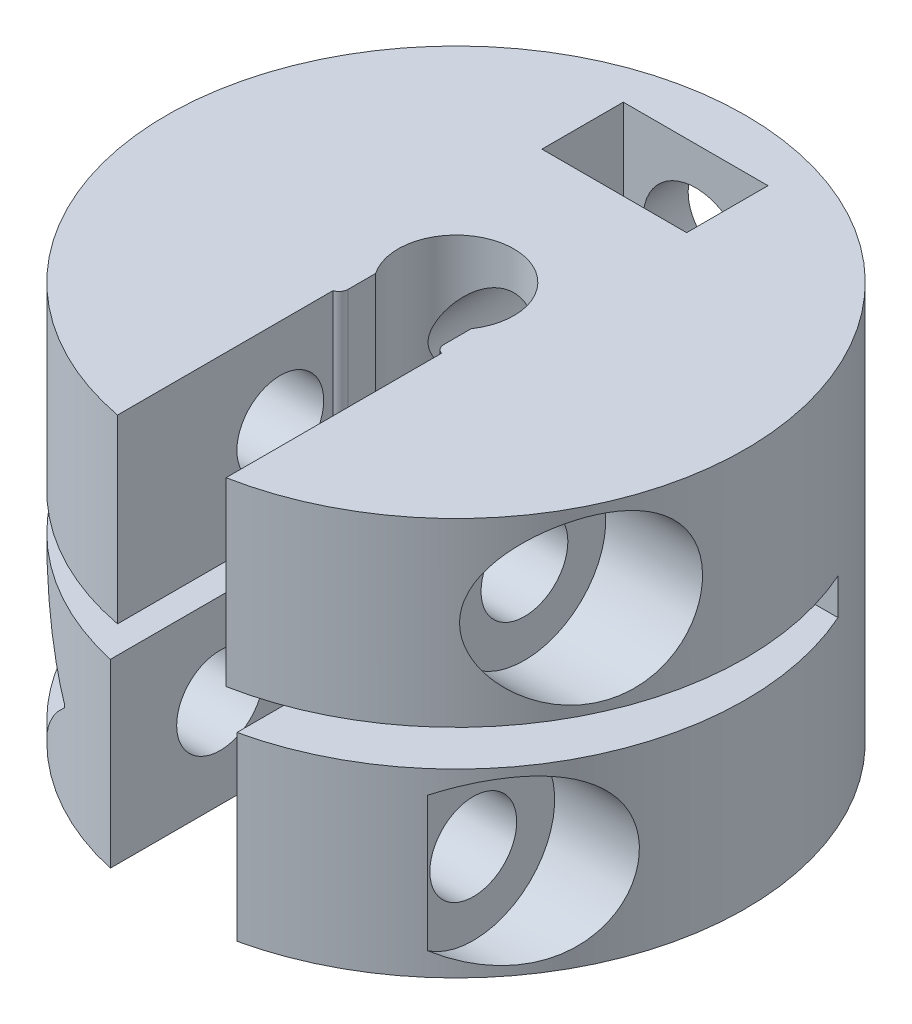
from build123d import *
from build123d.topology import SkipClean

# Parameters (mm, degrees)
SKETCH1_W                            = 4.75
SKETCH1_H                            = 7
FILLET1_R                            = 1
SKETCH16_W                           = 16
SKETCH16_H                           = 1
CUT_EXTRUDE5_DEPTH                   = 1
CUT_EXTRUDE5_DIRECTION_2_REACH       = 18.492
CUT_EXTRUDE6_REACH                   = 15.304
SKETCH17_W                           = 3.5
SKETCH17_H                           = 5.261387212
CUT_EXTRUDE7_DEPTH                   = 18.408690359
CUT_EXTRUDE7_DEPTH_BACK              = 18.408690359
SKETCH18_R                           = 1.2
CUT_EXTRUDE10_START                  = -6
SKETCH21_R                           = 1.6
CUT_EXTRUDE10_DEPTH                  = 6
CUT_EXTRUDE11_DEPTH                  = 18.26991621
CUT_EXTRUDE11_DEPTH_BACK             = 18.26991621
SKETCH22_R                           = 1.2
CUT_EXTRUDE9_REACH                   = 20.603
CUT_EXTRUDE9_END_RADIUS              = 8
SKETCH20_R                           = 1.2
CUT_EXTRUDE12_REACH                  = 21.585
SKETCH19_R                           = 2.25
CUT_EXTRUDE13_REACH                  = 21.585
CUT_EXTRUDE13_END_RADIUS             = 8
SKETCH24_R                           = 2.25
CUT_EXTRUDE14_REACH                  = 18.492
CUT_EXTRUDE14_END_RADIUS             = 8
SKETCH25_W                           = 2.25
SKETCH25_H                           = 1
CUT_EXTRUDE14_DIRECTION_2_REACH      = 18.492
CUT_EXTRUDE14_DIRECTION_2_END_RADIUS = 8
M2_5_CLEARANCE_HOLE1_D               = 2.9
M2_5_CLEARANCE_HOLE1_DEPTH           = 8.029752102
M2_5_CLEARANCE_HOLE1_TIP             = 0.871247898
CUT_EXTRUDE15_START                  = -12
SKETCH29_W                           = 4
SKETCH29_H                           = 2.25
CUT_EXTRUDE15_DEPTH                  = 12
FILLET3_R                            = 0.25
SKETCH30_R                           = 8
CUT_EXTRUDE19_DEPTH                  = 1
BOSS_EXTRUDE1_START                  = 1
BOSS_EXTRUDE1_DEPTH                  = 1


with BuildPart() as part:
    # Sketch1 → Revolve1 (revolve)
    with BuildSketch(Plane.XY, mode=Mode.PRIVATE) as revolve1_sk:
        with Locations((5.625, 3.5)):
            Rectangle(SKETCH1_W, SKETCH1_H)
    revolve(revolve1_sk.sketch.rotate(Axis((0, 0, 0), (0, 1, 0)), 90), axis=Axis((0, 0, 0), (0, 1, 0)))

    # Sketch1<3> → Revolve2 (revolve)
    with BuildSketch(Plane.XY, mode=Mode.PRIVATE) as revolve2_sk:
        Polygon((1.6, 7), (3.25, 7), (8, 7), (8, 12), (1.6, 12), align=None)
    revolve(revolve2_sk.sketch.rotate(Axis((0, 0, 0), (0, 1, 0)), 90), axis=Axis((0, 0, 0), (0, 1, 0)))

    # Fillet1
    fillet1_edges = [part.edges().sort_by_distance(p)[0] for p in [
        (0, 12, 8),
    ]]
    fillet(fillet1_edges, radius=FILLET1_R)

    # Sketch16 → Cut-Extrude5 (cut)
    with BuildSketch(Plane.XY):
        with Locations((0, 5.5)):
            Rectangle(SKETCH16_W, SKETCH16_H)
    extrude(amount=-CUT_EXTRUDE5_DEPTH, mode=Mode.SUBTRACT)

    # Sketch16 → Cut-Extrude5 direction 2 (cut, up to next)
    with BuildSketch(Plane.XY, mode=Mode.PRIVATE) as cut_extrude5_direction_2_sk1:
        with Locations((0, 5.5)):
            Rectangle(SKETCH16_W, SKETCH16_H)
    cut_extrude5_direction_2_tool1 = extrude(cut_extrude5_direction_2_sk1.sketch, amount=CUT_EXTRUDE5_DIRECTION_2_REACH, mode=Mode.PRIVATE) & part.part
    add(cut_extrude5_direction_2_tool1.solids().sort_by_distance((0, 5.5, 0))[0], mode=Mode.SUBTRACT)

    # Sketch17 → Cut-Extrude6 (cut, up to next)
    with BuildSketch(Plane(origin=(0, 5, 0), x_dir=(1, 0, 0), z_dir=(0, 1, 0)), mode=Mode.PRIVATE) as cut_extrude6_sk1:
        with Locations((0, -5.369306394)):
            Rectangle(SKETCH17_W, SKETCH17_H)
    cut_extrude6_tool1 = extrude(cut_extrude6_sk1.sketch, amount=-CUT_EXTRUDE6_REACH, mode=Mode.PRIVATE) & part.part
    add(cut_extrude6_tool1.solids().sort_by_distance((0, 5, 5.369306))[0], mode=Mode.SUBTRACT)

    # Sketch18 → Cut-Extrude7 (cut, two sides: drawn at the far end of the back side and taken through both)
    with BuildSketch(Plane.ZY.offset(-1.75).offset(-CUT_EXTRUDE7_DEPTH_BACK)):
        with Locations((4.772430143, 2.5)):
            Circle(SKETCH18_R)
    extrude(amount=CUT_EXTRUDE7_DEPTH + CUT_EXTRUDE7_DEPTH_BACK, mode=Mode.SUBTRACT)

    # Sketch21 → Cut-Extrude10 (cut)
    with BuildSketch(Plane(origin=(0, 12, 0), x_dir=(1, 0, 0), z_dir=(0, 1, 0)).offset(CUT_EXTRUDE10_START)):
        Circle(SKETCH21_R)
        Polygon((-1.5, -1.9), (-1.5, -11.891029443), (1.5, -11.891029443), (1.5, -1.9), (1.322875656, -1.9), (1.322875656, -0.9), (-1.322875656, -0.9), (-1.322875656, -1.9), align=None)
    extrude(amount=CUT_EXTRUDE10_DEPTH, mode=Mode.SUBTRACT)

    # Sketch22 → Cut-Extrude11 (cut, two sides: drawn at the far end of the back side and taken through both)
    with BuildSketch(Plane(origin=(-1.5, 0, 0), x_dir=(0, 0, -1), z_dir=(1, 0, 0)).offset(-CUT_EXTRUDE11_DEPTH_BACK)):
        with Locations((-3.358116823, 8.5)):
            Circle(SKETCH22_R)
    extrude(amount=CUT_EXTRUDE11_DEPTH + CUT_EXTRUDE11_DEPTH_BACK, mode=Mode.SUBTRACT)

    # Cut-Extrude9: up to this cylinder (the profile starts inside it)
    cut_extrude9_end = Plane(origin=(0, 5.9847245, 0), z_dir=(0, -1, 0)) * Cylinder(CUT_EXTRUDE9_END_RADIUS, 65.175449, mode=Mode.PRIVATE)
    # Sketch20 → Cut-Extrude9 (cut, up to the surface)
    with BuildSketch(Plane(origin=(-3.75, 0, 0), x_dir=(0, 0, -1), z_dir=(1, 0, 0)), mode=Mode.PRIVATE) as cut_extrude9_sk1:
        Polygon((-2.463029066, 2.5), (-3.617729604, 4.5), (-5.927130681, 4.5), (-7.08183122, 2.5), (-5.927130681, 0.5), (-3.617729604, 0.5), align=None)
    cut_extrude9_tool1 = extrude(cut_extrude9_sk1.sketch, amount=-CUT_EXTRUDE9_REACH, mode=Mode.PRIVATE) & cut_extrude9_end
    add(cut_extrude9_tool1.solids().sort_by_distance((-3.75, 2.5, 4.77243))[0], mode=Mode.SUBTRACT)
    # Sketch20 → Cut-Extrude9 (cut, up to the surface)
    with BuildSketch(Plane(origin=(-3.75, 0, 0), x_dir=(0, 0, -1), z_dir=(1, 0, 0)), mode=Mode.PRIVATE) as cut_extrude9_sk2:
        Polygon((-1.048715746, 8.5), (-2.203416284, 10.5), (-4.512817361, 10.5), (-5.6675179, 8.5), (-4.512817361, 6.5), (-2.203416284, 6.5), align=None)
        with Locations((-3.358116823, 8.5)):
            Circle(SKETCH20_R, mode=Mode.SUBTRACT)
    cut_extrude9_tool2 = extrude(cut_extrude9_sk2.sketch, amount=-CUT_EXTRUDE9_REACH, mode=Mode.PRIVATE) & cut_extrude9_end
    add(cut_extrude9_tool2.solids().sort_by_distance((-3.75, 9.469449, 1.678981))[0], mode=Mode.SUBTRACT)

    # Sketch19 → Cut-Extrude12 (cut, up to next)
    with BuildSketch(Plane.ZY.offset(-5.25), mode=Mode.PRIVATE) as cut_extrude12_sk1:
        with Locations((4.772430143, 2.5)):
            Circle(SKETCH19_R)
    cut_extrude12_tool1 = extrude(cut_extrude12_sk1.sketch, amount=-CUT_EXTRUDE12_REACH, mode=Mode.PRIVATE) & part.part
    add(cut_extrude12_tool1.solids().sort_by_distance((5.25, 2.5, 4.77243))[0], mode=Mode.SUBTRACT)

    # Cut-Extrude13: up to this cylinder (the profile starts inside it)
    cut_extrude13_end = Plane(origin=(0, 8.5, 0), z_dir=(0, -1, 0)) * Cylinder(CUT_EXTRUDE13_END_RADIUS, 60.17, mode=Mode.PRIVATE)
    # Sketch24 → Cut-Extrude13 (cut, up to the surface)
    with BuildSketch(Plane.ZY.offset(-5.25), mode=Mode.PRIVATE) as cut_extrude13_sk1:
        with Locations((3.358116823, 8.5)):
            Circle(SKETCH24_R)
    cut_extrude13_tool1 = extrude(cut_extrude13_sk1.sketch, amount=-CUT_EXTRUDE13_REACH, mode=Mode.PRIVATE) & cut_extrude13_end
    add(cut_extrude13_tool1.solids().sort_by_distance((5.25, 8.5, 3.358117))[0], mode=Mode.SUBTRACT)

    # Cut-Extrude14: up to this cylinder (the profile starts inside it)
    cut_extrude14_end = Plane(origin=(0, 5.5, 0), z_dir=(0, -1, 0)) * Cylinder(CUT_EXTRUDE14_END_RADIUS, 53.984, mode=Mode.PRIVATE)
    # Sketch25 → Cut-Extrude14 (cut, up to the surface)
    with BuildSketch(Plane.ZY, mode=Mode.PRIVATE) as cut_extrude14_sk1:
        with Locations((-2.125, 5.5)):
            Rectangle(SKETCH25_W, SKETCH25_H)
    cut_extrude14_tool1 = extrude(cut_extrude14_sk1.sketch, amount=-CUT_EXTRUDE14_REACH, mode=Mode.PRIVATE) & cut_extrude14_end
    add(cut_extrude14_tool1.solids().sort_by_distance((0, 5.5, -2.125))[0], mode=Mode.SUBTRACT)

    # Cut-Extrude14 direction 2: up to this cylinder (the profile starts inside it)
    cut_extrude14_direction_2_end = Plane(origin=(0, 5.5, 0), z_dir=(0, -1, 0)) * Cylinder(CUT_EXTRUDE14_DIRECTION_2_END_RADIUS, 53.984, mode=Mode.PRIVATE)
    # Sketch25 → Cut-Extrude14 direction 2 (cut, up to the surface)
    with BuildSketch(Plane.ZY, mode=Mode.PRIVATE) as cut_extrude14_direction_2_sk1:
        with Locations((-2.125, 5.5)):
            Rectangle(SKETCH25_W, SKETCH25_H)
    cut_extrude14_direction_2_tool1 = extrude(cut_extrude14_direction_2_sk1.sketch, amount=CUT_EXTRUDE14_DIRECTION_2_REACH, mode=Mode.PRIVATE) & cut_extrude14_direction_2_end
    add(cut_extrude14_direction_2_tool1.solids().sort_by_distance((0, 5.5, -2.125))[0], mode=Mode.SUBTRACT)

    # M2.5 Clearance Hole1
    with Locations(Plane(origin=(0, 0, -8), x_dir=(-1, 0, 0), z_dir=(0, 0, -1))):
        with Locations((0, 8.5), (0, 2.5)):
            Hole(M2_5_CLEARANCE_HOLE1_D / 2, depth=M2_5_CLEARANCE_HOLE1_DEPTH)
            with Locations((0, 0, -(M2_5_CLEARANCE_HOLE1_DEPTH + M2_5_CLEARANCE_HOLE1_TIP / 2))):  # 118° drill point
                Cone(0, M2_5_CLEARANCE_HOLE1_D / 2, M2_5_CLEARANCE_HOLE1_TIP, mode=Mode.SUBTRACT)

    # Sketch29 → Cut-Extrude15 (cut)
    with BuildSketch(Plane(origin=(0, 12, 0), x_dir=(1, 0, 0), z_dir=(0, 1, 0)).offset(CUT_EXTRUDE15_START)):
        with Locations((0, 5.5)):
            Rectangle(SKETCH29_W, SKETCH29_H)
    extrude(amount=CUT_EXTRUDE15_DEPTH, mode=Mode.SUBTRACT)

    # Fillet3
    # the kernel refuses this fillet: 0.25 mm, written as the material it takes off along each edge
    with BuildSketch(Plane(origin=(-1.322875656, 6.402143732, 1.9), x_dir=(-1, 0, 0), z_dir=(0, 1, 0))) as fillet3_piece_1:
        with BuildLine():
            CenterArc((0.25, -0.239142507), FILLET3_R, 106.94793725, 73.05206275)
            Line((0, -0.239142507), (-0.005, -0.239142507))
            Line((-0.005, -0.239142507), (-0.005, 0))
            Line((-0.005, 0), (0, 0.005))
            ThreePointArc((0, 0.005), (0.088562172, 0.005), (0.175666831, 0.00478285))
            Line((0.175666831, 0.00478285), (0.177124344, 0))
        make_face()
    extrude(amount=6.195712537, mode=Mode.SUBTRACT)
    with BuildSketch(Plane(origin=(1.322875656, 6.402143732, 1.9), x_dir=(1, 0, 0), z_dir=(0, 1, 0))) as fillet3_piece_2:
        with BuildLine():
            CenterArc((0.25, 0.239142507), FILLET3_R, 180, 73.05206275)
            Line((0, 0.239142507), (-0.005, 0.239142507))
            Line((-0.005, 0.239142507), (-0.005, 0))
            Line((-0.005, 0), (0, -0.005))
            ThreePointArc((0, -0.005), (0.088562172, -0.005), (0.175666831, -0.00478285))
            Line((0.175666831, -0.00478285), (0.177124344, 0))
        make_face()
    extrude(amount=6.195712537, mode=Mode.SUBTRACT)

    # Sketch30 → Cut-Extrude19 (cut)
    with BuildSketch(Plane(origin=(0, 12, 0), x_dir=(1, 0, 0), z_dir=(0, 1, 0))):
        Circle(SKETCH30_R)
    extrude(amount=-CUT_EXTRUDE19_DEPTH, mode=Mode.SUBTRACT)

    # Sketch31 → Boss-Extrude1 (add)
    with SkipClean():  # the faces are left unmerged after this step: merging them gives an invalid solid
        with BuildSketch(Plane.XZ.offset(-7).offset(BOSS_EXTRUDE1_START)):
            with BuildLine():
                Line((-1.322875656, 0.9), (-1.322875656, 1.660857493))
                ThreePointArc((-1.322875656, 1.660857493), (-1.371979023, 1.809654479), (-1.5, 1.9))
                Line((-1.5, 1.9), (-1.5, 2.883140649))
                ThreePointArc((-1.5, 2.883140649), (0, -3.25), (1.5, 2.883140649))
                Line((1.5, 2.883140649), (1.5, 1.9))
                ThreePointArc((1.5, 1.9), (1.371979023, 1.809654479), (1.322875656, 1.660857493))
                Line((1.322875656, 1.660857493), (1.322875656, 0.9))
                ThreePointArc((1.322875656, 0.9), (0, -1.6), (-1.322875656, 0.9))
            make_face()
        extrude(amount=-BOSS_EXTRUDE1_DEPTH)


solid = part.part
